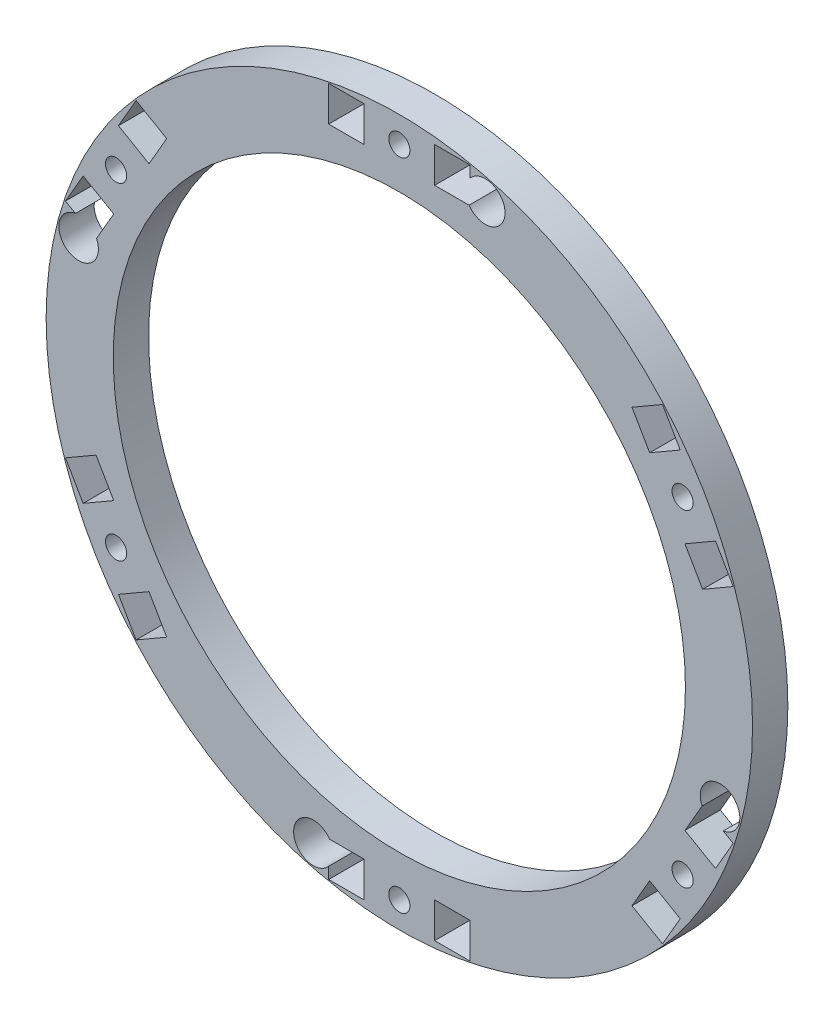
from build123d import *

# Parameters (mm, degrees)
BOSS_EXTRU_1_OUTLINE_R   = 50
BOSS_EXTRU_1_OUTLINE_W   = 5
BOSS_EXTRU_1_OUTLINE_H   = 5
BOSS_EXTRU_1_OUTLINE_R_2 = 1.5
BOSS_EXTRU_1_DEPTH       = 5
SKETCH4_R                = 2.8
CUT_EXTRUDE4_DEPTH       = 10
SKETCH5_R                = 40.5
CUT_EXTRUDE5_DEPTH       = 10


# Read off the part's stored shape, not the designer's step: Boss.-Extru.1
with BuildPart() as part:
    # Boss.-Extru.1 outline → Boss.-Extru.1 (new body)
    with BuildSketch(Plane.XY):
        Circle(BOSS_EXTRU_1_OUTLINE_R)
        Polygon((-37.262039705, -33.060254038), (-39.762039705, -28.730127019), (-35.431912686, -26.230127019), (-32.931912686, -30.560254038), align=None, mode=Mode.SUBTRACT)
        with Locations((-7.5, -46.3)):
            Rectangle(BOSS_EXTRU_1_OUTLINE_W, BOSS_EXTRU_1_OUTLINE_H, mode=Mode.SUBTRACT)
        with Locations((-40.096976195, -23.15)):
            Circle(BOSS_EXTRU_1_OUTLINE_R_2, mode=Mode.SUBTRACT)
        Polygon((-42.931912686, -13.239745962), (-40.431912686, -17.569872981), (-44.762039705, -20.069872981), (-47.262039705, -15.739745962), align=None, mode=Mode.SUBTRACT)
        with Locations((0, -46.3)):
            Circle(BOSS_EXTRU_1_OUTLINE_R_2, mode=Mode.SUBTRACT)
        with Locations((7.5, -46.3)):
            Rectangle(BOSS_EXTRU_1_OUTLINE_W, BOSS_EXTRU_1_OUTLINE_H, mode=Mode.SUBTRACT)
        Polygon((32.931912686, -30.560254038), (35.431912686, -26.230127019), (39.762039705, -28.730127019), (37.262039705, -33.060254038), align=None, mode=Mode.SUBTRACT)
        with Locations((40.096976195, -23.15)):
            Circle(BOSS_EXTRU_1_OUTLINE_R_2, mode=Mode.SUBTRACT)
        Polygon((47.262039705, -15.739745962), (44.762039705, -20.069872981), (40.431912686, -17.569872981), (42.931912686, -13.239745962), align=None, mode=Mode.SUBTRACT)
        Polygon((-47.262039705, 15.739745962), (-44.762039705, 20.069872981), (-40.431912686, 17.569872981), (-42.931912686, 13.239745962), align=None, mode=Mode.SUBTRACT)
        with Locations((-40.096976195, 23.15)):
            Circle(BOSS_EXTRU_1_OUTLINE_R_2, mode=Mode.SUBTRACT)
        Polygon((-32.931912686, 30.560254038), (-35.431912686, 26.230127019), (-39.762039705, 28.730127019), (-37.262039705, 33.060254038), align=None, mode=Mode.SUBTRACT)
        with Locations((-7.5, 46.3)):
            Rectangle(BOSS_EXTRU_1_OUTLINE_W, BOSS_EXTRU_1_OUTLINE_H, mode=Mode.SUBTRACT)
        Polygon((42.931912686, 13.239745962), (40.431912686, 17.569872981), (44.762039705, 20.069872981), (47.262039705, 15.739745962), align=None, mode=Mode.SUBTRACT)
        with Locations((40.096976195, 23.15)):
            Circle(BOSS_EXTRU_1_OUTLINE_R_2, mode=Mode.SUBTRACT)
        with Locations((0, 46.3)):
            Circle(BOSS_EXTRU_1_OUTLINE_R_2, mode=Mode.SUBTRACT)
        with Locations((7.5, 46.3)):
            Rectangle(BOSS_EXTRU_1_OUTLINE_W, BOSS_EXTRU_1_OUTLINE_H, mode=Mode.SUBTRACT)
        Polygon((37.262039705, 33.060254038), (39.762039705, 28.730127019), (35.431912686, 26.230127019), (32.931912686, 30.560254038), align=None, mode=Mode.SUBTRACT)
    extrude(amount=BOSS_EXTRU_1_DEPTH)

    # Sketch4 → Cut-Extrude4 (cut)
    with BuildSketch(Plane.XY.offset(5)):
        with Locations((-12.16449512, -45.398513836)):
            Circle(SKETCH4_R)
        with Locations((-45.398513836, 12.16449512)):
            Circle(SKETCH4_R)
        with Locations((12.16449512, 45.398513836)):
            Circle(SKETCH4_R)
        with Locations((45.398513836, -12.16449512)):
            Circle(SKETCH4_R)
    extrude(amount=-CUT_EXTRUDE4_DEPTH, mode=Mode.SUBTRACT)

    # Sketch5 → Cut-Extrude5 (cut)
    with BuildSketch(Plane.XY.offset(5)):
        Circle(SKETCH5_R)
    extrude(amount=-CUT_EXTRUDE5_DEPTH, mode=Mode.SUBTRACT)


solid = part.part
